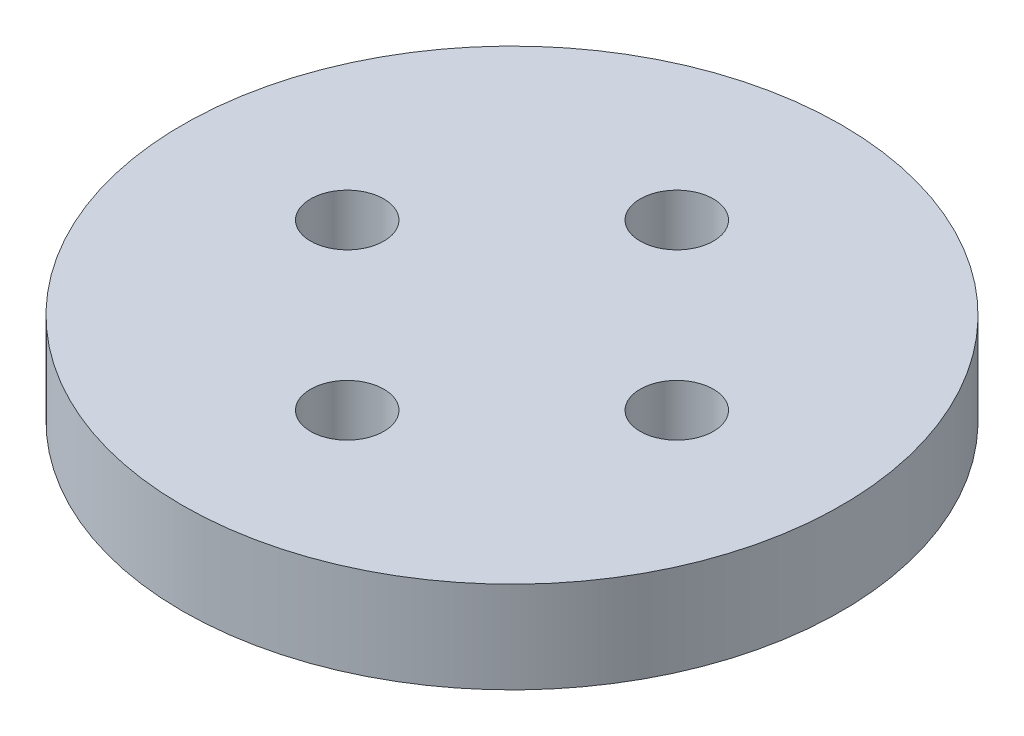
from build123d import *

# Parameters (mm, degrees)
SKETCH_1_R      = 18
SKETCH_1_R_2    = 2
EXTRUDE_1_DEPTH = 5


with BuildPart() as part:
    # 草图1 → 凸台-拉伸1 (new body)
    with BuildSketch(Plane(origin=(0, 0, 0), x_dir=(1, 0, 0), z_dir=(0, 1, 0))):
        Circle(SKETCH_1_R)
        with Locations((0, 9)):
            Circle(SKETCH_1_R_2, mode=Mode.SUBTRACT)
        with Locations((9, 0)):
            Circle(SKETCH_1_R_2, mode=Mode.SUBTRACT)
        with Locations((-9, 0)):
            Circle(SKETCH_1_R_2, mode=Mode.SUBTRACT)
        with Locations((0, -9)):
            Circle(SKETCH_1_R_2, mode=Mode.SUBTRACT)
    extrude(amount=EXTRUDE_1_DEPTH)


solid = part.part
